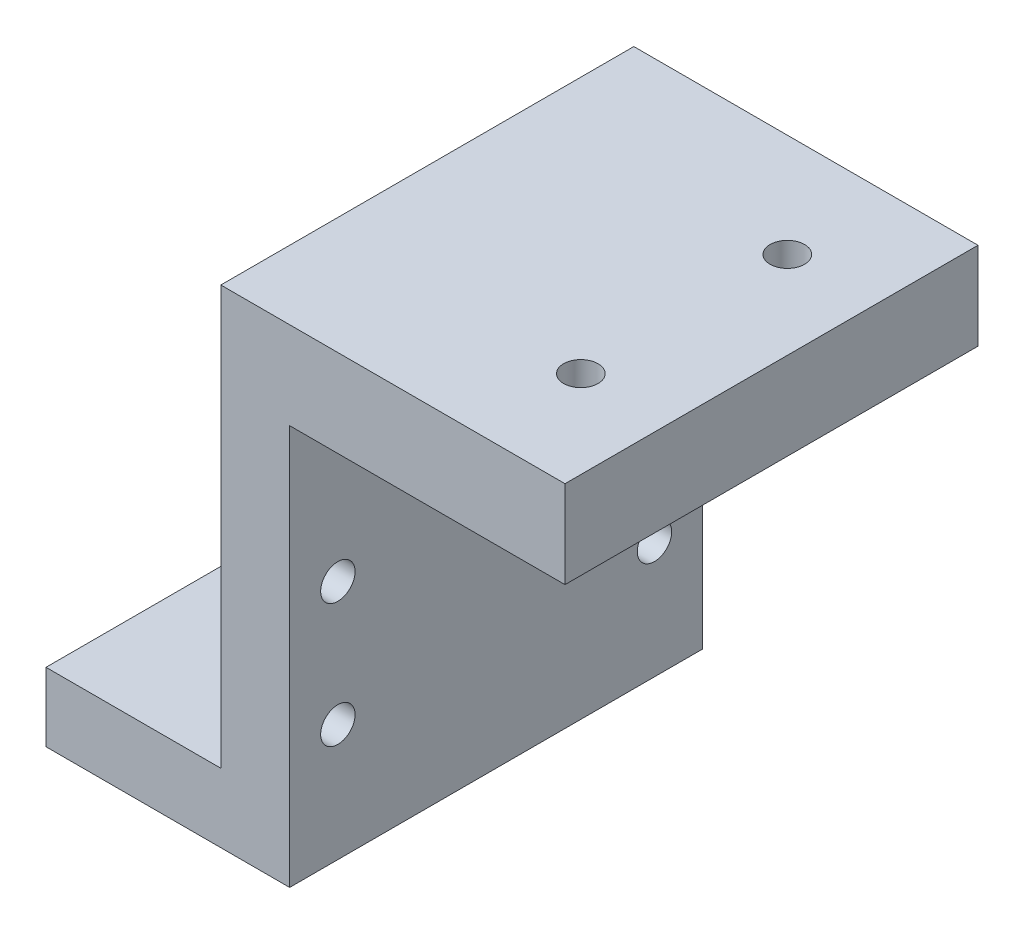
from build123d import *

# Parameters (mm, degrees)
SKETCH1_W             = 50
SKETCH1_H             = 12.7
BOSS_EXTRUDE1_DEPTH   = 60
SKETCH2_W             = 10
SKETCH2_H             = 60
BOSS_EXTRUDE2_DEPTH   = 58.1
SKETCH3_W             = 60
SKETCH3_H             = 10
BOSS_EXTRUDE3_DEPTH   = 25.4
M5X0_8_TAPPED_HOLE1_D = 5
M5X0_8_TAPPED_HOLE2_D = 5


with BuildPart() as part:
    # Sketch1 → Boss-Extrude1 (new body)
    with BuildSketch(Plane.XY):
        Rectangle(SKETCH1_W, SKETCH1_H)
    extrude(amount=BOSS_EXTRUDE1_DEPTH)

    # Sketch2 → Boss-Extrude2 (add)
    with BuildSketch(Plane.XZ.offset(6.35)):
        with Locations((-20, 30)):
            Rectangle(SKETCH2_W, SKETCH2_H)
    extrude(amount=BOSS_EXTRUDE2_DEPTH)

    # Sketch3 → Boss-Extrude3 (add)
    with BuildSketch(Plane.ZY.offset(25)):
        with Locations((30, -59.45)):
            Rectangle(SKETCH3_W, SKETCH3_H)
    extrude(amount=BOSS_EXTRUDE3_DEPTH)

    # M5x0.8 Tapped Hole1 (through all)
    with Locations(Plane(origin=(0, 6.35, 0), x_dir=(1, 0, 0), z_dir=(0, 1, 0))):
        with Locations((12.3, -45), (12.3, -15)):
            Hole(M5X0_8_TAPPED_HOLE1_D / 2)

    # M5x0.8 Tapped Hole2 (through all)
    with Locations(Plane(origin=(-15, 0, 0), x_dir=(0, 0, -1), z_dir=(1, 0, 0))):
        with Locations((-7, -29.45), (-53, -47.45), (-7, -47.45), (-53, -29.45)):
            Hole(M5X0_8_TAPPED_HOLE2_D / 2)


solid = part.part
